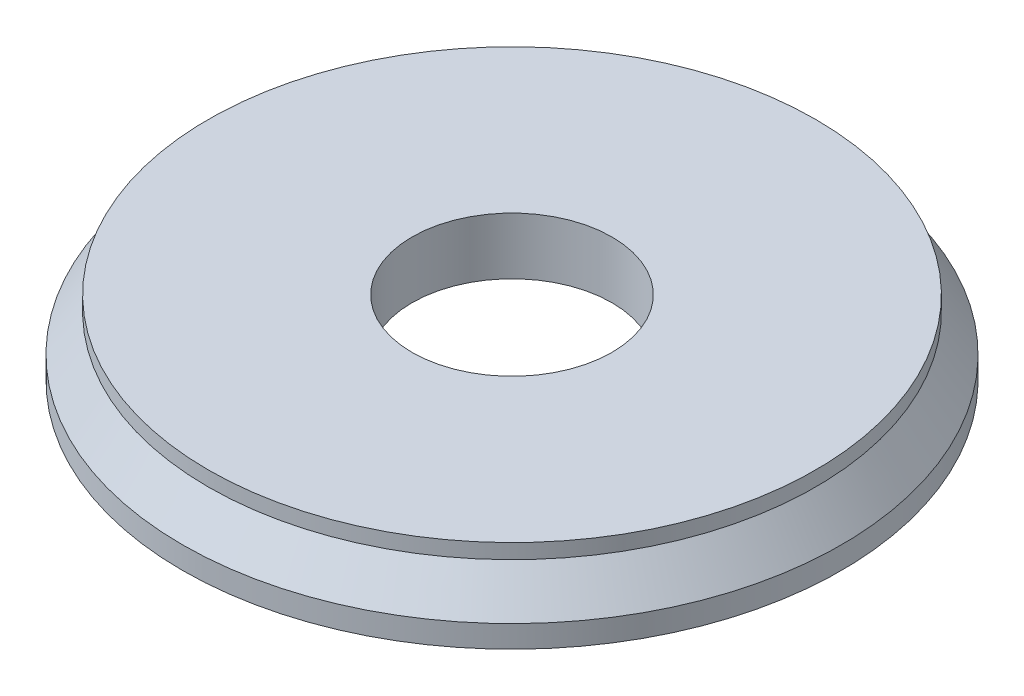
from build123d import *

# Parameters (mm, degrees)
CHAMFER_1_SIZE  = 4
CHAMFER_1_SIZE2 = 2.309401077


with BuildPart() as part:
    # Эскиз1 → Повернуть1 (revolve)
    with BuildSketch(Plane.XY):
        Polygon((13.5, 0), (44.5, 0), (44.5, 3), (41, 8), (41, 10), (13.5, 10), align=None)
    revolve(axis=Axis((0, 0, 0), (0, 1, 0)))

    # Фаска1
    chamfer_1_edges = [part.edges().sort_by_distance(p)[0] for p in [
        (-13.5, 0, 0),
    ]]
    chamfer_1_side = [part.faces().sort_by_distance(p)[0] for p in [
        (-14.758650071, 0, 0),
    ]]
    chamfer(chamfer_1_edges, length=CHAMFER_1_SIZE, length2=CHAMFER_1_SIZE2, reference=chamfer_1_side[0])


solid = part.part
